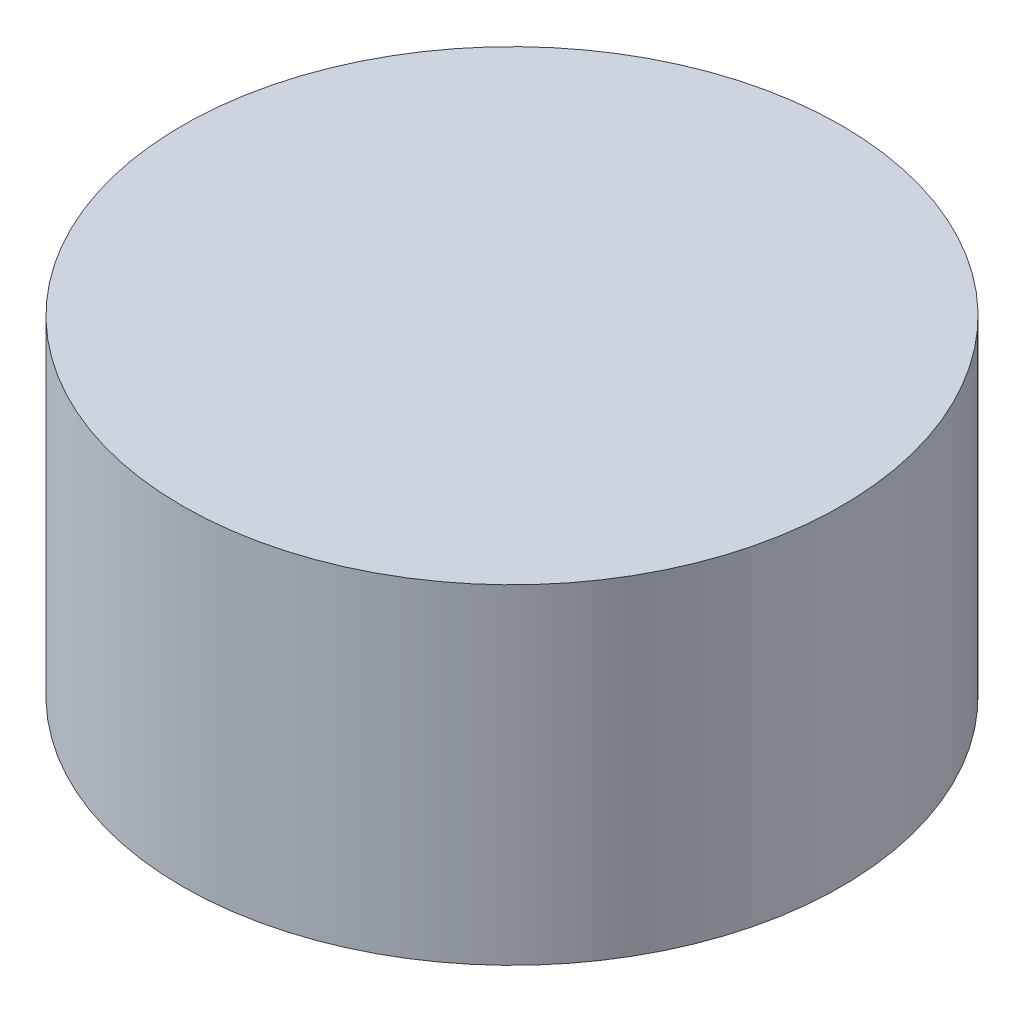
from build123d import *

# Parameters (mm, degrees)
SKETCH_1_R        = 50
EXTRUDE_1_DEPTH   = 50
SHELL_START       = 5
SHELL_1_OUTLINE_R = 40
SHELL_1_DEPTH     = 35
SKETCH_2_R        = 5
EXTRUDE_2_DEPTH   = 9


# Read off the part's stored shape, not the designer's step: 抽壳1
with BuildPart() as part:
    # 草图1 → 凸台-拉伸1 (new body)
    with BuildSketch(Plane(origin=(0, 0, 0), x_dir=(1, 0, 0), z_dir=(0, 1, 0))):
        with Locations(Location((0, 0, 0), (0, 0, 270))):
            Circle(SKETCH_1_R)
    extrude(amount=EXTRUDE_1_DEPTH)

    # 抽壳1 outline → 抽壳1 (cut)
    with BuildSketch(Plane(origin=(0, 0, 0), x_dir=(1, 0, 0), z_dir=(0, 1, 0)).offset(SHELL_START)):
        Circle(SHELL_1_OUTLINE_R)
    extrude(amount=SHELL_1_DEPTH, mode=Mode.SUBTRACT)

    # 草图2 → 凸台-拉伸2 (add)
    with BuildSketch(Plane.XZ):
        with Locations(Location((0, 0, 0), (0, 0, 90))):
            Circle(SKETCH_2_R)
    extrude(amount=EXTRUDE_2_DEPTH)


solid = part.part
